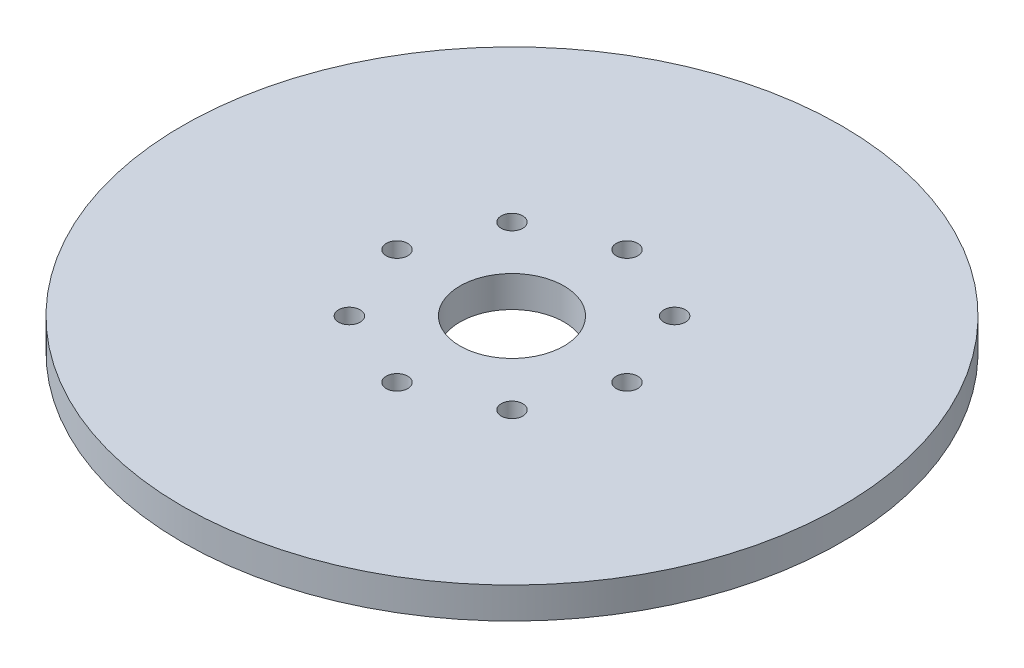
from build123d import *

# Parameters (mm, degrees)
SKETCH1_R           = 95
BOSS_EXTRUDE1_DEPTH = 9
SKETCH2_R           = 15
CUT_EXTRUDE1_DEPTH  = 135.651401775
SKETCH3_R           = 3.107652879
CUT_EXTRUDE2_DEPTH  = 7.045423675
CIRPATTERN1_COUNT   = 8


with BuildPart() as part:
    # Sketch1 → Boss-Extrude1 (new body)
    with BuildSketch(Plane(origin=(0, 0, 0), x_dir=(1, 0, 0), z_dir=(0, 1, 0))):
        Circle(SKETCH1_R)
    extrude(amount=BOSS_EXTRUDE1_DEPTH)

    # Sketch2 → Cut-Extrude1 (cut, through all)
    with BuildSketch(Plane(origin=(0, 0, 0), x_dir=(1, 0, 0), z_dir=(0, 1, 0))):
        Circle(SKETCH2_R)
    extrude(amount=CUT_EXTRUDE1_DEPTH, mode=Mode.SUBTRACT)

    # Sketch3 → Cut-Extrude2 (cut)
    with BuildSketch(Plane(origin=(0, 9, 0), x_dir=(1, 0, 0), z_dir=(0, 1, 0))):
        with Locations((-33.15170901, 0)):
            Circle(SKETCH3_R)
    cut_extrude2 = extrude(amount=-CUT_EXTRUDE2_DEPTH, mode=Mode.SUBTRACT)

    # CirPattern1: Cut-Extrude2 ×8 about axis
    cirpattern1_axis = Axis((0, 0, 0), (0, 1, 0))
    for i in range(1, CIRPATTERN1_COUNT):
        add(cut_extrude2.rotate(cirpattern1_axis, i * 360 / CIRPATTERN1_COUNT), mode=Mode.SUBTRACT)


solid = part.part
